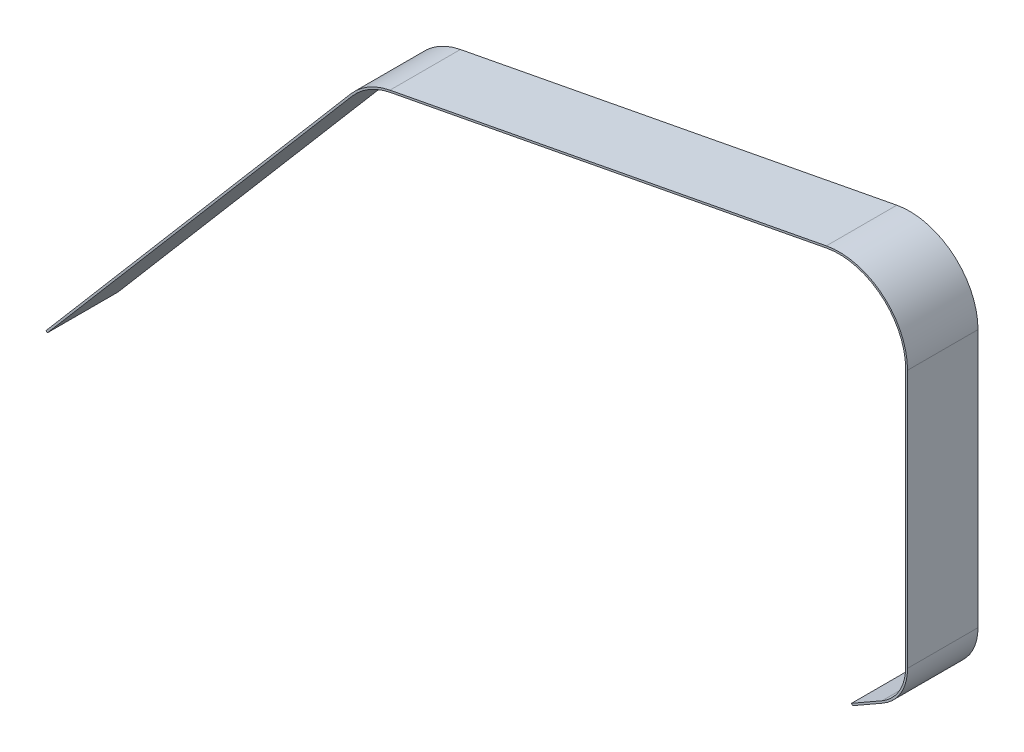
from build123d import *

# Parameters (mm, degrees)
BOSS_EXTRUDE1_DEPTH = 38.1


with BuildPart() as part:
    # Sketch1 → Boss-Extrude1 (new body)
    with BuildSketch(Plane.XY):
        with BuildLine():
            Line((229.052656436, 81.384103362), (-6.935300935, 36.310776905))
            ThreePointArc((-6.935300935, 36.310776905), (-18.583880119, 31.956381494), (-28.129385158, 23.985591698))
            Line((-28.129385158, 23.985591698), (-192.93350566, -169.290381629))
            Line((-192.93350566, -169.290381629), (-192.160401767, -169.949598111))
            Line((-192.160401767, -169.949598111), (-27.356368354, 23.326449476))
            ThreePointArc((-27.356368354, 23.326449476), (-18.073181022, 31.078195933), (-6.744713614, 35.31292926))
            Line((-6.744713614, 35.31292926), (229.243243758, 80.386255718))
            ThreePointArc((229.243243758, 80.386255718), (258.868882307, 72.803407755), (271.939135403, 45.156590096))
            Line((271.939135403, 45.156590096), (271.939135403, -94.543409904))
            ThreePointArc((271.939135403, -94.543409904), (268.517306447, -107.276045041), (259.173781266, -116.578058163))
            Line((259.173781266, -116.578058163), (242.663781266, -126.044876093))
            Line((242.663781266, -126.044876093), (243.169167101, -126.926262023))
            Line((243.169167101, -126.926262023), (259.679167101, -117.459444094))
            ThreePointArc((259.679167101, -117.459444094), (269.404165408, -107.771994819), (272.955117371, -94.512545144))
            Line((272.955117371, -94.512545144), (272.955117371, 45.073326458))
            ThreePointArc((272.955117371, 45.073326458), (259.548438469, 73.559720559), (229.052656436, 81.384103362))
        make_face()
    extrude(amount=BOSS_EXTRUDE1_DEPTH)


solid = part.part
